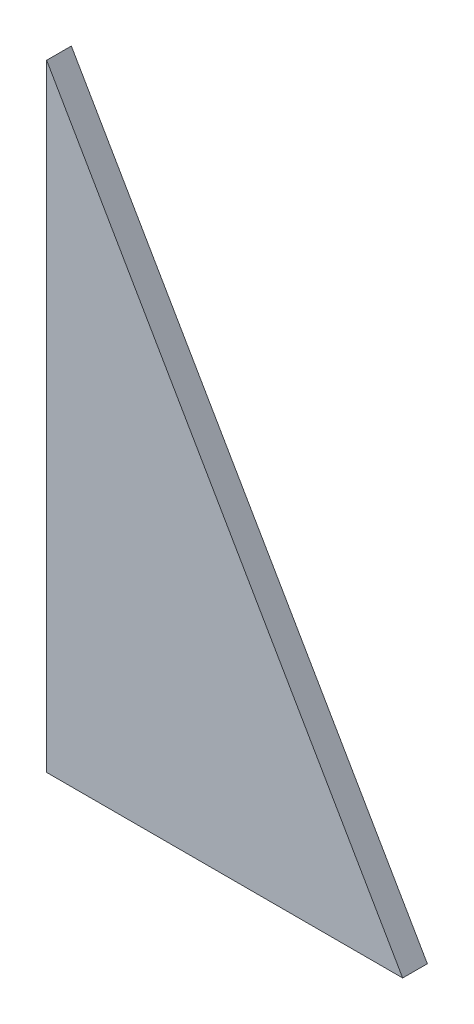
from build123d import *

# Parameters (mm, degrees)
EXTRUDE1_DEPTH = 2.54
EXTRUDE3_DEPTH = 2.032
EXTRUDE2_DEPTH = 0.9144
FILLET1_R      = 1.5875


with BuildPart() as part:
    # Sketch1 → Extrude1 (new body)
    with BuildSketch(Plane.XY):
        Polygon((0, 63.5), (36.6522, 0), (0, 0), align=None)
    extrude(amount=EXTRUDE1_DEPTH)

    # Sketch4 → Extrude3 (cut)
    with BuildSketch(Plane(origin=(0, 0, 0), x_dir=(-1, 0, 0), z_dir=(0, 0, -1))):
        Polygon((0, 31.75), (0, 35.306), (-10.668, 35.306), (-10.668, 28.194), (0, 28.194), align=None)
    extrude(amount=-EXTRUDE3_DEPTH, mode=Mode.SUBTRACT)

    # Sketch3 → Extrude2 (cut)
    with BuildSketch(Plane(origin=(0, 0, 0), x_dir=(-1, 0, 0), z_dir=(0, 0, -1))):
        Polygon((-2.54, 31.75), (-2.54, 20.955), (-19.315938, 20.955), (-6.85419, 42.545), (-2.54, 42.545), align=None)
    extrude(amount=-EXTRUDE2_DEPTH, mode=Mode.SUBTRACT)

    # Fillet1
    fillet1_edges = [part.edges().sort_by_distance(p)[0] for p in [
        (2.54, 20.955, 0.4572),
        (10.668, 35.306, 1.4732),
        (10.668, 28.194, 1.4732),
        (19.315938, 20.955, 0.4572),
        (6.85419, 42.545, 0.4572),
        (2.54, 42.545, 0.4572),
    ]]
    fillet(fillet1_edges, radius=FILLET1_R)


solid = part.part
